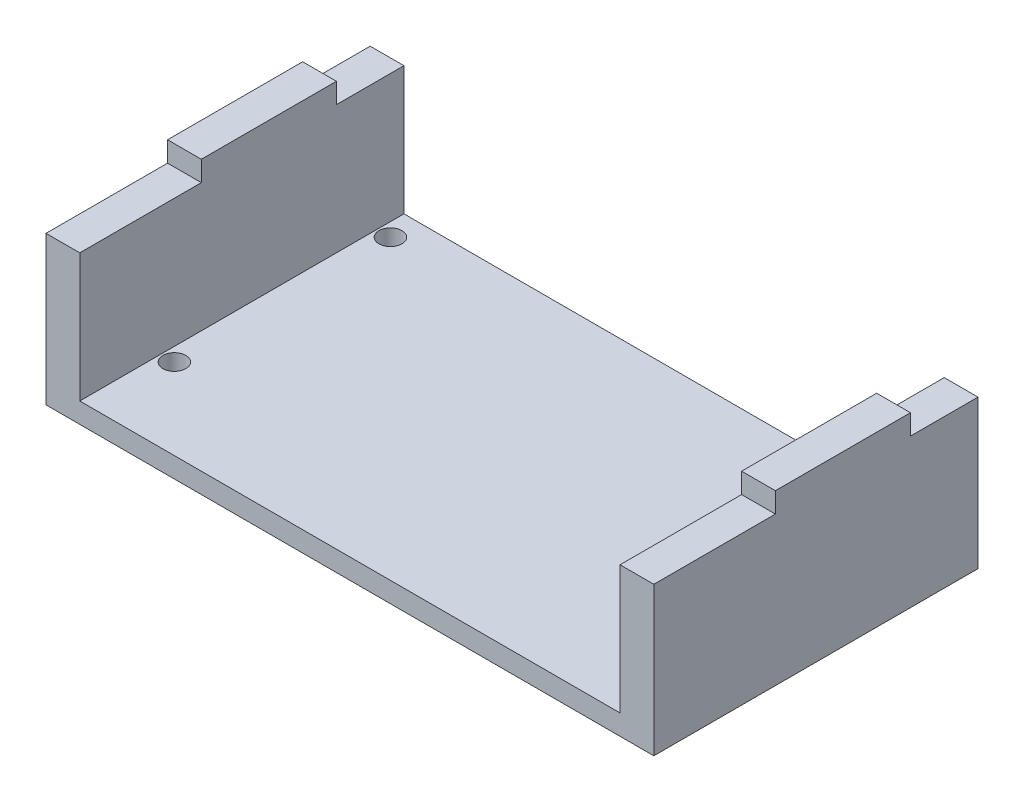
from build123d import *

# Parameters (mm, degrees)
SKETCH1_W                = 90
SKETCH1_H                = 48
BOSS_EXTRUDE1_DEPTH      = 3
SKETCH2_W                = 5
SKETCH2_H                = 48
BOSS_EXTRUDE2_DEPTH      = 22
SKETCH3_W                = 5
SKETCH3_H                = 48
BOSS_EXTRUDE3_DEPTH      = 22
SKETCH4_W                = 5
SKETCH4_H                = 10
SKETCH4_H_2              = 18
CUT_EXTRUDE1_DEPTH       = 3
M3_CLEARANCE_HOLE1_D     = 3.4
M3_CLEARANCE_HOLE1_DEPTH = 5
M3_CLEARANCE_HOLE1_TIP   = 1.021463052


with BuildPart() as part:
    # Sketch1 → Boss-Extrude1 (new body)
    with BuildSketch(Plane(origin=(0, 0, 0), x_dir=(1, 0, 0), z_dir=(0, 1, 0))):
        with Locations((0, -4)):
            Rectangle(SKETCH1_W, SKETCH1_H)
    extrude(amount=BOSS_EXTRUDE1_DEPTH)

    # Sketch2 → Boss-Extrude2 (add)
    with BuildSketch(Plane(origin=(0, 3, 0), x_dir=(1, 0, 0), z_dir=(0, 1, 0))):
        with Locations((-42.5, -4)):
            Rectangle(SKETCH2_W, SKETCH2_H)
    extrude(amount=BOSS_EXTRUDE2_DEPTH)

    # Sketch3 → Boss-Extrude3 (add)
    with BuildSketch(Plane(origin=(0, 3, 0), x_dir=(1, 0, 0), z_dir=(0, 1, 0))):
        with Locations((42.5, -4)):
            Rectangle(SKETCH3_W, SKETCH3_H)
    extrude(amount=BOSS_EXTRUDE3_DEPTH)

    # Sketch4 → Cut-Extrude1 (cut)
    with BuildSketch(Plane(origin=(0, 25, 0), x_dir=(1, 0, 0), z_dir=(0, 1, 0))):
        with Locations((-42.5, 15)):
            Rectangle(SKETCH4_W, SKETCH4_H)
        with Locations((-42.5, -19)):
            Rectangle(SKETCH4_W, SKETCH4_H_2)
        with Locations((42.5, 15)):
            Rectangle(SKETCH4_W, SKETCH4_H)
        with Locations((42.5, -19)):
            Rectangle(SKETCH4_W, SKETCH4_H_2)
    extrude(amount=-CUT_EXTRUDE1_DEPTH, mode=Mode.SUBTRACT)

    # M3 Clearance Hole1
    with Locations(Plane(origin=(0, 0, 0), x_dir=(-1, 0, 0), z_dir=(0, -1, 0))):
        with Locations((-38, 16), (-38, -16), (38, -16), (38, 16)):
            Hole(M3_CLEARANCE_HOLE1_D / 2, depth=M3_CLEARANCE_HOLE1_DEPTH)
            with Locations((0, 0, -(M3_CLEARANCE_HOLE1_DEPTH + M3_CLEARANCE_HOLE1_TIP / 2))):  # 118° drill point
                Cone(0, M3_CLEARANCE_HOLE1_D / 2, M3_CLEARANCE_HOLE1_TIP, mode=Mode.SUBTRACT)


solid = part.part
